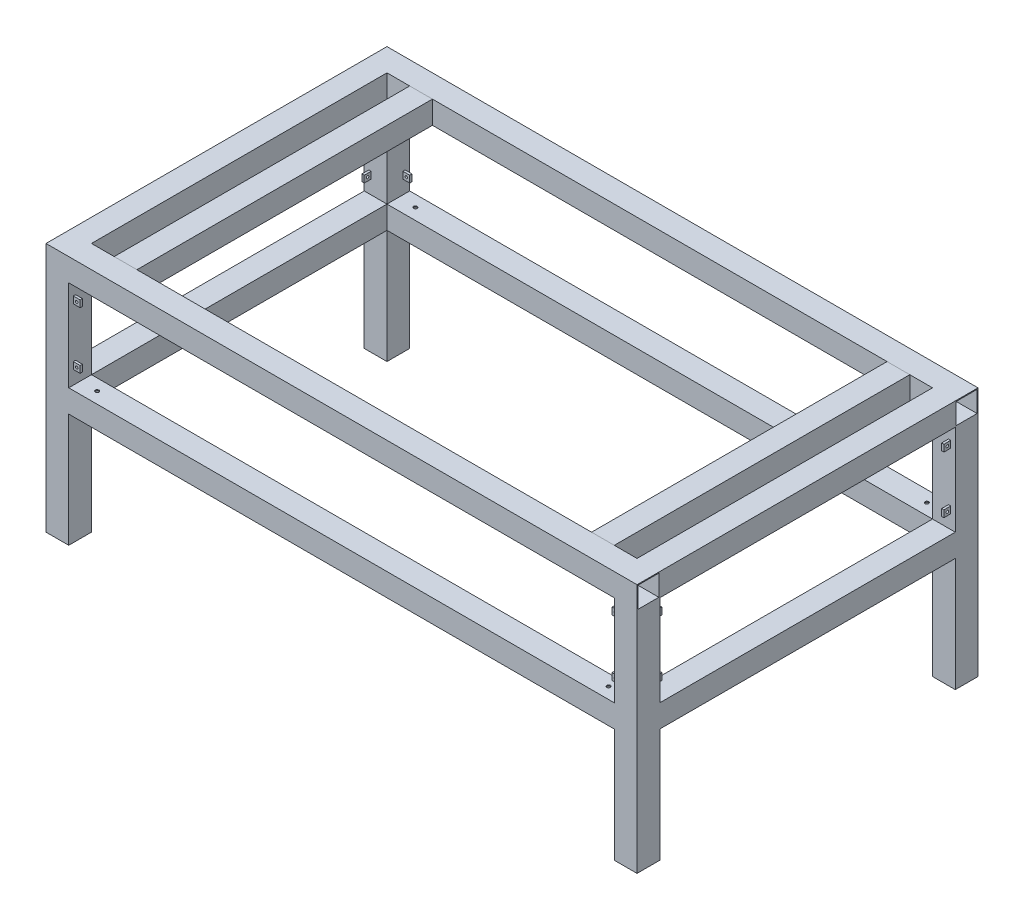
from build123d import *

# Parameters (mm, degrees)
ESQUISSE1_W             = 1300
ESQUISSE1_H             = 750
ESQUISSE1_W_2           = 1200
ESQUISSE1_H_2           = 650
BOSS_EXTRU_1_DEPTH      = 550
ESQUISSE2_W             = 1200
ESQUISSE2_H             = 200
ESQUISSE2_H_2           = 250
ENL_V_MAT_EXTRU_1_DEPTH = 1599.436736315
ESQUISSE3_W             = 650
ESQUISSE3_H             = 200
ESQUISSE3_H_2           = 250
ENL_V_MAT_EXTRU_2_DEPTH = 1599.436736315
ESQUISSE4_W             = 50
ESQUISSE4_H             = 650
BOSS_EXTRU_2_DEPTH      = 50
BOSS_EXTRU_2_2_DEPTH    = 50
ESQUISSE5_W             = 5
ESQUISSE5_H             = 15
BOSS_EXTRU_3_DEPTH      = 15
ESQUISSE6_W             = 5
ESQUISSE6_H             = 15
BOSS_EXTRU_4_DEPTH      = 15
ESQUISSE7_W             = 5
ESQUISSE7_H             = 15
BOSS_EXTRU_5_DEPTH      = 15
ESQUISSE8_W             = 5
ESQUISSE8_H             = 15
BOSS_EXTRU_6_DEPTH      = 15
ESQUISSE10_W            = 5
ESQUISSE10_H            = 15
BOSS_EXTRU_7_DEPTH      = 15
ESQUISSE12_W            = 5
ESQUISSE12_H            = 15
BOSS_EXTRU_8_DEPTH      = 15
ESQUISSE14_W            = 5
ESQUISSE14_H            = 15
BOSS_EXTRU_9_DEPTH      = 15
ESQUISSE15_W            = 5
ESQUISSE15_H            = 15
BOSS_EXTRU_10_DEPTH     = 15
ESQUISSE16_R            = 2.75
ENL_V_MAT_EXTRU_3_DEPTH = 1500
ESQUISSE17_R            = 2.75
ENL_V_MAT_EXTRU_4_DEPTH = 1000
ESQUISSE18_R            = 4
ENL_V_MAT_EXTRU_5_DEPTH = 80
ESQUISSE19_R            = 15
ENL_V_MAT_EXTRU_6_DEPTH = 48
ESQUISSE20_W            = 46
ESQUISSE20_H            = 46
ENL_V_MAT_EXTRU_7_DEPTH = 10000
ESQUISSE21_W            = 46
ESQUISSE21_H            = 46
ENL_V_MAT_EXTRU_8_DEPTH = 500


with BuildPart() as part:
    # Esquisse1 → Boss.-Extru.1 (new body)
    with BuildSketch(Plane(origin=(0, 0, 0), x_dir=(1, 0, 0), z_dir=(0, 1, 0))):
        with Locations((650, 375)):
            Rectangle(ESQUISSE1_W, ESQUISSE1_H)
        with Locations((650, 375)):
            Rectangle(ESQUISSE1_W_2, ESQUISSE1_H_2, mode=Mode.SUBTRACT)
    extrude(amount=-BOSS_EXTRU_1_DEPTH)

    # Esquisse2 → Enlèv. mat.-Extru.1 (cut, through all)
    with BuildSketch(Plane.XY):
        with Locations((650, -150)):
            Rectangle(ESQUISSE2_W, ESQUISSE2_H)
        with Locations((650, -425)):
            Rectangle(ESQUISSE2_W, ESQUISSE2_H_2)
    extrude(amount=-ENL_V_MAT_EXTRU_1_DEPTH, mode=Mode.SUBTRACT)

    # Esquisse3 → Enlèv. mat.-Extru.2 (cut, through all)
    with BuildSketch(Plane.ZY):
        with Locations((-375, -150)):
            Rectangle(ESQUISSE3_W, ESQUISSE3_H)
        with Locations((-375, -425)):
            Rectangle(ESQUISSE3_W, ESQUISSE3_H_2)
    extrude(amount=-ENL_V_MAT_EXTRU_2_DEPTH, mode=Mode.SUBTRACT)

    # Esquisse5 → Boss.-Extru.3 (add)
    with BuildSketch(Plane.ZY.offset(-1250)):
        with Locations((-737.5, -87.5)):
            Rectangle(ESQUISSE5_W, ESQUISSE5_H)
        with Locations((-737.5, -212.5)):
            Rectangle(ESQUISSE5_W, ESQUISSE5_H)
    extrude(amount=BOSS_EXTRU_3_DEPTH)

    # Esquisse6 → Boss.-Extru.4 (add)
    with BuildSketch(Plane.XY.offset(-700)):
        with Locations((1287.5, -87.5)):
            Rectangle(ESQUISSE6_W, ESQUISSE6_H)
        with Locations((1287.5, -212.5)):
            Rectangle(ESQUISSE6_W, ESQUISSE6_H)
    extrude(amount=BOSS_EXTRU_4_DEPTH)

    # Esquisse7 → Boss.-Extru.5 (add)
    with BuildSketch(Plane(origin=(50, 0, 0), x_dir=(0, 0, -1), z_dir=(1, 0, 0))):
        with Locations((737.5, -87.5)):
            Rectangle(ESQUISSE7_W, ESQUISSE7_H)
        with Locations((737.5, -212.5)):
            Rectangle(ESQUISSE7_W, ESQUISSE7_H)
    extrude(amount=BOSS_EXTRU_5_DEPTH)

    # Esquisse8 → Boss.-Extru.6 (add)
    with BuildSketch(Plane.XY.offset(-700)):
        with Locations((12.5, -87.5)):
            Rectangle(ESQUISSE8_W, ESQUISSE8_H)
        with Locations((12.5, -212.5)):
            Rectangle(ESQUISSE8_W, ESQUISSE8_H)
    extrude(amount=BOSS_EXTRU_6_DEPTH)

    # Esquisse10 → Boss.-Extru.7 (add)
    with BuildSketch(Plane(origin=(50, 0, 0), x_dir=(0, 0, -1), z_dir=(1, 0, 0))):
        with Locations((12.5, -87.5)):
            Rectangle(ESQUISSE10_W, ESQUISSE10_H)
        with Locations((12.5, -212.5)):
            Rectangle(ESQUISSE10_W, ESQUISSE10_H)
    extrude(amount=BOSS_EXTRU_7_DEPTH)

    # Esquisse12 → Boss.-Extru.8 (add)
    with BuildSketch(Plane(origin=(0, 0, -50), x_dir=(-1, 0, 0), z_dir=(0, 0, -1))):
        with Locations((-12.5, -87.5)):
            Rectangle(ESQUISSE12_W, ESQUISSE12_H)
        with Locations((-12.5, -212.5)):
            Rectangle(ESQUISSE12_W, ESQUISSE12_H)
    extrude(amount=BOSS_EXTRU_8_DEPTH)

    # Esquisse14 → Boss.-Extru.9 (add)
    with BuildSketch(Plane.ZY.offset(-1250)):
        with Locations((-12.5, -87.5)):
            Rectangle(ESQUISSE14_W, ESQUISSE14_H)
        with Locations((-12.5, -212.5)):
            Rectangle(ESQUISSE14_W, ESQUISSE14_H)
    extrude(amount=BOSS_EXTRU_9_DEPTH)

    # Esquisse15 → Boss.-Extru.10 (add)
    with BuildSketch(Plane(origin=(0, 0, -50), x_dir=(-1, 0, 0), z_dir=(0, 0, -1))):
        with Locations((-1287.5, -87.5)):
            Rectangle(ESQUISSE15_W, ESQUISSE15_H)
        with Locations((-1287.5, -212.5)):
            Rectangle(ESQUISSE15_W, ESQUISSE15_H)
    extrude(amount=BOSS_EXTRU_10_DEPTH)

    # Esquisse16 → Enlèv. mat.-Extru.3 (cut)
    with BuildSketch(Plane(origin=(1290, 0, 0), x_dir=(0, 0, -1), z_dir=(1, 0, 0))):
        with Locations((57.5, -87.5)):
            Circle(ESQUISSE16_R)
        with Locations((57.5, -212.5)):
            Circle(ESQUISSE16_R)
        with Locations((692.5, -87.5)):
            Circle(ESQUISSE16_R)
        with Locations((692.5, -212.5)):
            Circle(ESQUISSE16_R)
    extrude(amount=-ENL_V_MAT_EXTRU_3_DEPTH, mode=Mode.SUBTRACT)

    # Esquisse17 → Enlèv. mat.-Extru.4 (cut)
    with BuildSketch(Plane.XY.offset(-10)):
        with Locations((57.5, -87.5)):
            Circle(ESQUISSE17_R)
        with Locations((57.5, -212.5)):
            Circle(ESQUISSE17_R)
        with Locations((1242.5, -212.5)):
            Circle(ESQUISSE17_R)
        with Locations((1242.5, -87.5)):
            Circle(ESQUISSE17_R)
    extrude(amount=-ENL_V_MAT_EXTRU_4_DEPTH, mode=Mode.SUBTRACT)

    # Esquisse18 → Enlèv. mat.-Extru.5 (cut)
    with BuildSketch(Plane(origin=(0, -250, 0), x_dir=(1, 0, 0), z_dir=(0, 1, 0))):
        with Locations((1212.5, 25)):
            Circle(ESQUISSE18_R)
        with Locations((87.5, 25)):
            Circle(ESQUISSE18_R)
        with Locations((87.5, 725)):
            Circle(ESQUISSE18_R)
        with Locations((1212.5, 725)):
            Circle(ESQUISSE18_R)
    extrude(amount=-ENL_V_MAT_EXTRU_5_DEPTH, mode=Mode.SUBTRACT)

    # Esquisse19 → Enlèv. mat.-Extru.6 (cut)
    with BuildSketch(Plane(origin=(0, -300, 0), x_dir=(-1, 0, 0), z_dir=(0, -1, 0))):
        with Locations((-1212.5, 725)):
            Circle(ESQUISSE19_R)
        with Locations((-87.5, 725)):
            Circle(ESQUISSE19_R)
        with Locations((-87.5, 25)):
            Circle(ESQUISSE19_R)
        with Locations((-1212.5, 25)):
            Circle(ESQUISSE19_R)
    extrude(amount=-ENL_V_MAT_EXTRU_6_DEPTH, mode=Mode.SUBTRACT)

    # Esquisse20 → Enlèv. mat.-Extru.7 (cut)
    with BuildSketch(Plane.ZY):
        with Locations((-25, -25)):
            Rectangle(ESQUISSE20_W, ESQUISSE20_H)
        with Locations((-725, -25)):
            Rectangle(ESQUISSE20_W, ESQUISSE20_H)
    extrude(amount=-ENL_V_MAT_EXTRU_7_DEPTH, mode=Mode.SUBTRACT)

    # Esquisse21 → Enlèv. mat.-Extru.8 (cut)
    with BuildSketch(Plane(origin=(0, -550, 0), x_dir=(-1, 0, 0), z_dir=(0, -1, 0))):
        with Locations((-1275, 25)):
            Rectangle(ESQUISSE21_W, ESQUISSE21_H)
        with Locations((-1275, 725)):
            Rectangle(ESQUISSE21_W, ESQUISSE21_H)
        with Locations((-25, 725)):
            Rectangle(ESQUISSE21_W, ESQUISSE21_H)
        with Locations((-25, 25)):
            Rectangle(ESQUISSE21_W, ESQUISSE21_H)
    extrude(amount=-ENL_V_MAT_EXTRU_8_DEPTH, mode=Mode.SUBTRACT)


with BuildPart() as body_2:
    # Esquisse4 → Boss.-Extru.2 (new body)
    with BuildSketch(Plane(origin=(0, 0, 0), x_dir=(1, 0, 0), z_dir=(0, 1, 0))):
        with Locations((125, 375)):
            Rectangle(ESQUISSE4_W, ESQUISSE4_H)
    extrude(amount=-BOSS_EXTRU_2_DEPTH)


with BuildPart() as body_3:
    # Esquisse4 → Boss.-Extru.2 2 (new body)
    with BuildSketch(Plane(origin=(0, 0, 0), x_dir=(1, 0, 0), z_dir=(0, 1, 0))):
        with Locations((1175, 375)):
            Rectangle(ESQUISSE4_W, ESQUISSE4_H)
    extrude(amount=-BOSS_EXTRU_2_2_DEPTH)


solid = Compound([part.part, body_2.part, body_3.part])
